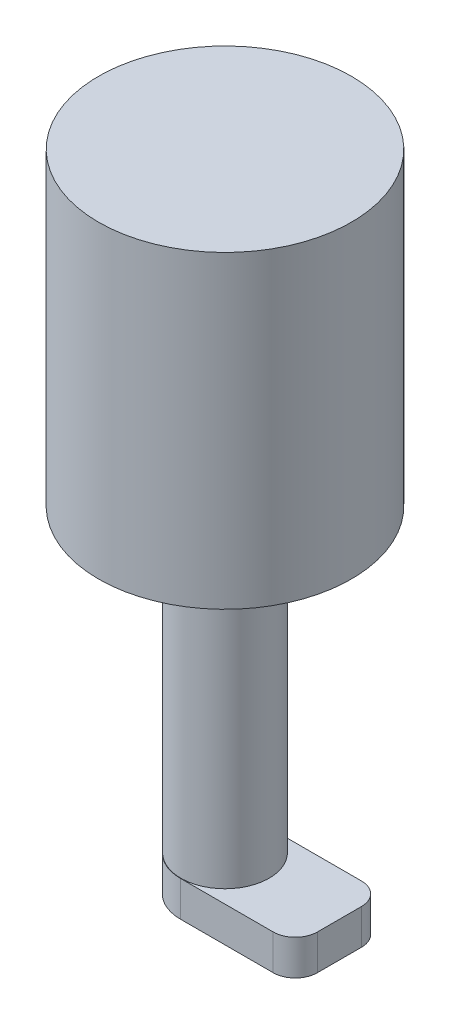
from build123d import *

# Parameters (mm, degrees)
SKETCH2_R           = 28.64
BOSS_EXTRUDE1_DEPTH = 70
SKETCH3_R           = 10
BOSS_EXTRUDE2_DEPTH = 68
SKETCH7_W           = 36
SKETCH7_H           = 20
BOSS_EXTRUDE3_DEPTH = 8
FILLET1_R           = 10
FILLET2_R           = 5


with BuildPart() as part:
    # Sketch2 → Boss-Extrude1 (new body)
    with BuildSketch(Plane(origin=(0, 0, 0), x_dir=(1, 0, 0), z_dir=(0, 1, 0))):
        with Locations(Location((0, 0, 0), (0, 0, 270))):
            Circle(SKETCH2_R)
    extrude(amount=BOSS_EXTRUDE1_DEPTH)

    # Sketch3 → Boss-Extrude2 (add)
    with BuildSketch(Plane.XZ):
        with Locations(Location((0, 0, 0), (0, 0, 270))):
            Circle(SKETCH3_R)
    extrude(amount=BOSS_EXTRUDE2_DEPTH)

    # Sketch7 → Boss-Extrude3 (add)
    with BuildSketch(Plane.XZ.offset(68)):
        with Locations((8, 0.077466393)):
            Rectangle(SKETCH7_W, SKETCH7_H)
    extrude(amount=BOSS_EXTRUDE3_DEPTH)

    # Fillet1
    # the kernel refuses this fillet: 10 mm, written as the material it takes off along each edge
    with BuildSketch(Plane(origin=(-10, -68, -9.922533607), x_dir=(1, 0, 0), z_dir=(0, -1, 0))) as fillet1_piece_1:
        with BuildLine():
            CenterArc((FILLET1_R, FILLET1_R), FILLET1_R, 180, 90)
            Line((0, FILLET1_R), (0, 0))
            Line((0, 0), (FILLET1_R, 0))
        make_face()
    extrude(amount=33, mode=Mode.SUBTRACT)
    with BuildSketch(Plane(origin=(-10, -43, 10.077466393), x_dir=(0, 0, -1), z_dir=(0, -1, 0))) as fillet1_piece_2:
        with BuildLine():
            CenterArc((FILLET1_R, FILLET1_R), FILLET1_R, 180, 90)
            Line((0, FILLET1_R), (0, 0))
            Line((0, 0), (FILLET1_R, 0))
        make_face()
    extrude(amount=58, mode=Mode.SUBTRACT)

    # Fillet2
    fillet2_edges = [part.edges().sort_by_distance(p)[0] for p in [
        (26, -72, -9.922533607),
        (26, -72, 10.077466393),
    ]]
    fillet(fillet2_edges, radius=FILLET2_R)


solid = part.part
